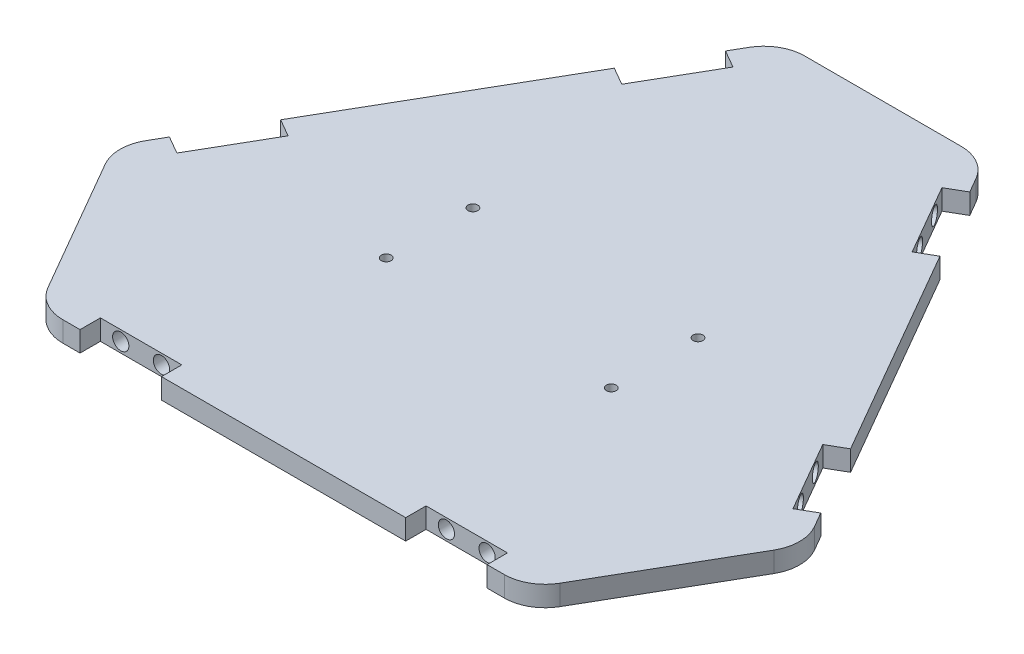
from build123d import *

# Parameters (mm, degrees)
BOSS_EXTRUDE1_DEPTH            = 2.5
CHAMFER1_SIZE                  = 50
SKETCH4_W                      = 20
SKETCH4_H                      = 5
SKETCH4_R                      = 2
CUT_EXTRUDE1_DEPTH             = 5
SKETCH4_2_R                    = 2
CUT_EXTRUDE2_DEPTH             = 10
CRVPATTERN1_START              = -63.508529611
CRVPATTERN1_OUTLINE_W          = 20
CRVPATTERN1_OUTLINE_H          = 5
CRVPATTERN1_DEPTH              = 5
CRVPATTERN1_START_2            = -58.508529611
CRVPATTERN1_2_OUTLINE_R        = 2
CRVPATTERN1_2_DEPTH            = 5
CRVPATTERN1_START_3            = 58.508529611
CRVPATTERN1_3_OUTLINE_W        = 20
CRVPATTERN1_3_OUTLINE_H        = 5
CRVPATTERN1_3_DEPTH            = 5
CRVPATTERN1_START_4            = 53.508529611
CRVPATTERN1_4_OUTLINE_R        = 2
CRVPATTERN1_4_DEPTH            = 5
FILLET1_R                      = 10
CBORE_FOR_M2_SHCS1_D           = 2.4
CBORE_FOR_M2_SHCS1_CBORE_D     = 4.4
CBORE_FOR_M2_SHCS1_CBORE_DEPTH = 2


# Read off the part's stored shape, not the designer's step: CrvPattern1
with BuildPart() as part:
    # Sketch1 → Boss-Extrude1 (new, symmetric)
    with BuildSketch(Plane(origin=(0, 0, 0), x_dir=(1, 0, 0), z_dir=(0, 1, 0))):
        Polygon((110, -63.508529611), (0, 127.017059222), (-110, -63.508529611), align=None)
    extrude(amount=BOSS_EXTRUDE1_DEPTH, both=True)

    # Chamfer1
    chamfer1_edges = [part.edges().sort_by_distance(p)[0] for p in [
        (-110, 0, 63.508529611),
        (0, 0, -127.017059222),
        (110, 0, 63.508529611),
    ]]
    chamfer(chamfer1_edges, length=CHAMFER1_SIZE)

    # Sketch4 → Cut-Extrude1 (cut)
    with BuildSketch(Plane(origin=(4.375288244, 0, 63.508529611), x_dir=(-1, 0, 0), z_dir=(0, 0, -1))):
        with Locations((44.375288244, 0)):
            Rectangle(SKETCH4_W, SKETCH4_H)
        with Locations((39.375288244, 0)):
            Circle(SKETCH4_R, mode=Mode.SUBTRACT)
        with Locations((49.375288244, 0)):
            Circle(SKETCH4_R, mode=Mode.SUBTRACT)
    cut_extrude1 = extrude(amount=CUT_EXTRUDE1_DEPTH, mode=Mode.SUBTRACT)

    # Sketch4<2> → Cut-Extrude2 (cut)
    with BuildSketch(Plane(origin=(4.375288244, 0, 63.508529611), x_dir=(-1, 0, 0), z_dir=(0, 0, -1))):
        with Locations(Location((49.375288244, 0, 0), (0, 0, 180))):
            Circle(SKETCH4_2_R)
        with Locations(Location((39.375288244, 0, 0), (0, 0, 180))):
            Circle(SKETCH4_2_R)
    cut_extrude2 = extrude(amount=CUT_EXTRUDE2_DEPTH, mode=Mode.SUBTRACT)

    # Mirror1: Cut-Extrude1, Cut-Extrude2 across plane
    add(cut_extrude1.mirror(Plane(origin=(0, 0, 0), x_dir=(0, 0, 1), z_dir=(1, 0, 0))), mode=Mode.SUBTRACT)
    add(cut_extrude2.mirror(Plane(origin=(0, 0, 0), x_dir=(0, 0, 1), z_dir=(1, 0, 0))), mode=Mode.SUBTRACT)

    # CrvPattern1 outline → CrvPattern1 (cut)
    with BuildSketch(Plane(origin=(0, 0, 0), x_dir=(0.499999999999987, 0, -0.8660254037844463), z_dir=(0.8660254037844461, 0, 0.49999999999998707)).offset(CRVPATTERN1_START)):
        with Locations((-40, 0)):
            Rectangle(CRVPATTERN1_OUTLINE_W, CRVPATTERN1_OUTLINE_H)
        with Locations((40, 0)):
            Rectangle(CRVPATTERN1_OUTLINE_W, CRVPATTERN1_OUTLINE_H)
    extrude(amount=CRVPATTERN1_DEPTH, mode=Mode.SUBTRACT)

    # CrvPattern1 2 outline → CrvPattern1 2 (cut)
    with BuildSketch(Plane(origin=(0, 0, 0), x_dir=(0.499999999999987, 0, -0.8660254037844463), z_dir=(0.8660254037844461, 0, 0.49999999999998707)).offset(CRVPATTERN1_START_2)):
        with Locations((-35, 0)):
            Circle(CRVPATTERN1_2_OUTLINE_R)
        with Locations((-45, 0)):
            Circle(CRVPATTERN1_2_OUTLINE_R)
        with Locations((35, 0)):
            Circle(CRVPATTERN1_2_OUTLINE_R)
        with Locations((45, 0)):
            Circle(CRVPATTERN1_2_OUTLINE_R)
    extrude(amount=CRVPATTERN1_2_DEPTH, mode=Mode.SUBTRACT)

    # CrvPattern1 3 outline → CrvPattern1 3 (cut)
    with BuildSketch(Plane(origin=(0, 0, 0), x_dir=(0.500000000000001, 0, 0.866025403784438), z_dir=(0.866025403784438, 0, -0.500000000000001)).offset(CRVPATTERN1_START_3)):
        with Locations((-40, 0)):
            Rectangle(CRVPATTERN1_3_OUTLINE_W, CRVPATTERN1_3_OUTLINE_H)
        with Locations((40, 0)):
            Rectangle(CRVPATTERN1_3_OUTLINE_W, CRVPATTERN1_3_OUTLINE_H)
    extrude(amount=CRVPATTERN1_3_DEPTH, mode=Mode.SUBTRACT)

    # CrvPattern1 4 outline → CrvPattern1 4 (cut)
    with BuildSketch(Plane(origin=(0, 0, 0), x_dir=(0.500000000000001, 0, 0.866025403784438), z_dir=(0.866025403784438, 0, -0.500000000000001)).offset(CRVPATTERN1_START_4)):
        with Locations((-35, 0)):
            Circle(CRVPATTERN1_4_OUTLINE_R)
        with Locations((-45, 0)):
            Circle(CRVPATTERN1_4_OUTLINE_R)
        with Locations((35, 0)):
            Circle(CRVPATTERN1_4_OUTLINE_R)
        with Locations((45, 0)):
            Circle(CRVPATTERN1_4_OUTLINE_R)
    extrude(amount=CRVPATTERN1_4_DEPTH, mode=Mode.SUBTRACT)

    # Fillet1
    fillet1_edges = [part.edges().sort_by_distance(p)[0] for p in [
        (60, 0, 63.508529611),
        (-60, 0, 63.508529611),
        (-25, 0, -83.715789032),
        (-85, 0, 20.207259422),
        (25, 0, -83.715789032),
        (85, 0, 20.207259422),
    ]]
    fillet(fillet1_edges, radius=FILLET1_R)

    # CBORE for M2 SHCS1 (through all)
    with Locations(Plane(origin=(0, -2.5, 0), x_dir=(-1, 0, 0), z_dir=(0, -1, 0))):
        with Locations((-27.65, -10.65), (27.65, 10.65), (27.65, -10.65), (-27.65, 10.65)):
            CounterBoreHole(CBORE_FOR_M2_SHCS1_D / 2, CBORE_FOR_M2_SHCS1_CBORE_D / 2, CBORE_FOR_M2_SHCS1_CBORE_DEPTH)


solid = part.part
